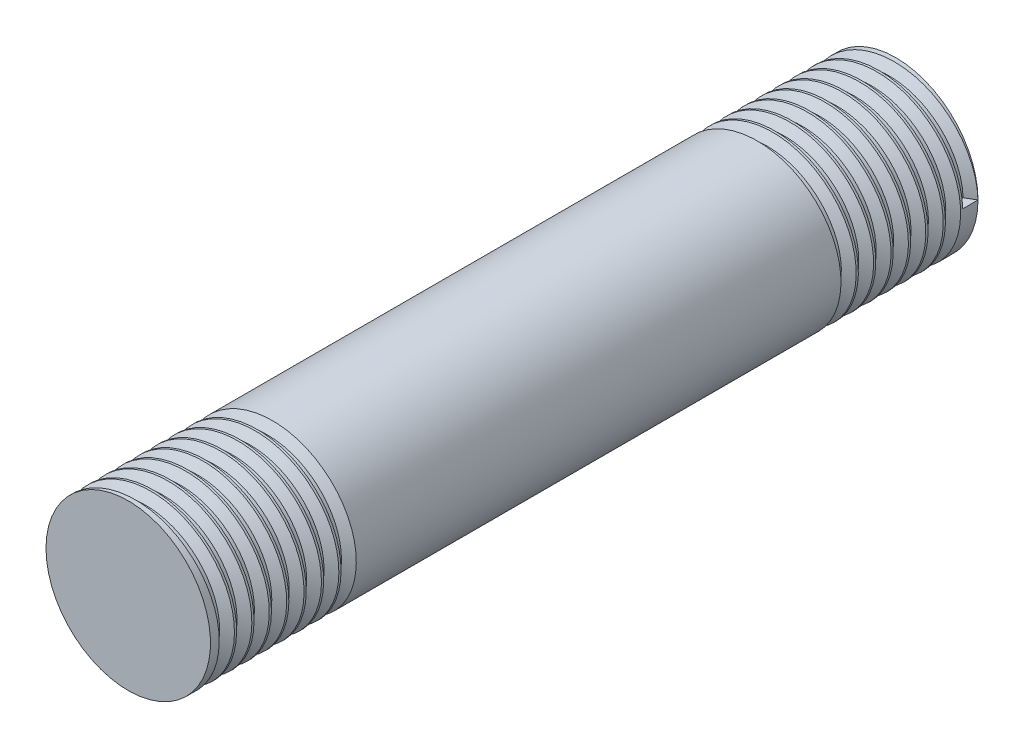
from build123d import *

# Parameters (mm, degrees)
SKETCH1_R           = 1.5
BOSS_EXTRUDE1_DEPTH = 14
THREAD1_PITCH       = 0.3175
THREAD2_PITCH       = 0.3175


with BuildPart() as part:
    # Sketch1 → Boss-Extrude1 (new body)
    with BuildSketch(Plane.XY):
        Circle(SKETCH1_R)
    extrude(amount=BOSS_EXTRUDE1_DEPTH)

    # Thread1: the profile of Thread Profile1 profile screwed along a right-hand helix of 7.874016 turns, 6 arcs to a turn; built about Z, then put on its axis
    thread1_z = Axis((0, 0, 0), (0, 0, 1))
    thread1_corners = [(1.5003, 0, -0.000173205), (1.5003, 0, 0.277985704), (1.328148085, 0, 0.17859375), (1.328148085, 0, 0.09921875)]
    with BuildLine(mode=Mode.PRIVATE) as thread1_profile:
        Line(thread1_corners[0], thread1_corners[1])
        Line(thread1_corners[1], thread1_corners[2])
        Line(thread1_corners[2], thread1_corners[3])
        Line(thread1_corners[3], thread1_corners[0])
    thread1_cap = Face(thread1_profile.wire())
    thread1_turn_angles = [0, 30, 60, 90, 120, 150, 180, 210, 240, 270, 300, 330, 360]
    thread1_turn_weights = [1, 0.8660254037844387, 1, 0.8660254037844387, 1, 0.8660254037844387, 1, 0.8660254037844387, 1, 0.8660254037844387, 1, 0.8660254037844387, 1]
    thread1_turn_rails = [Edge.make_bspline([Vector(p[0], p[1], 0).rotate(thread1_z, thread1_turn_angles[k]) / thread1_turn_weights[k] + Vector(0, 0, p[2] + THREAD1_PITCH * thread1_turn_angles[k] / 360) for k in range(13)], [0, 0, 0, 1, 1, 2, 2, 3, 3, 4, 4, 5, 5, 6, 6, 6], 2, thread1_turn_weights) for p in thread1_corners]
    thread1_turn_sides = [Face.make_surface_from_curves(thread1_turn_rails[p[0]], thread1_turn_rails[p[1]]) for p in [(0, 1), (1, 2), (2, 3), (3, 0)]]
    thread1_last_angles = [2520, 2550, 2580, 2610, 2640, 2670, 2700, 2730, 2760, 2790, 2820, 2827.322834646, 2834.645669291]
    thread1_last_weights = [1, 0.8660254037844387, 1, 0.8660254037844387, 1, 0.8660254037844387, 1, 0.8660254037844387, 1, 0.8660254037844387, 1, 0.9918437235207201, 1]
    thread1_last_rails = [Edge.make_bspline([Vector(p[0], p[1], 0).rotate(thread1_z, thread1_last_angles[k]) / thread1_last_weights[k] + Vector(0, 0, p[2] + THREAD1_PITCH * thread1_last_angles[k] / 360) for k in range(13)], [0, 0, 0, 1, 1, 2, 2, 3, 3, 4, 4, 5, 5, 6, 6, 6], 2, thread1_last_weights) for p in thread1_corners]
    thread1_last_sides = [Face.make_surface_from_curves(thread1_last_rails[p[0]], thread1_last_rails[p[1]]) for p in [(0, 1), (1, 2), (2, 3), (3, 0)]]
    thread1 = Plane(origin=(0, 0, 14), x_dir=(-1, 0, 0), z_dir=(0, 0, -1)) * Solid(Shell([*[p.moved(Location((0, 0, THREAD1_PITCH * i))) for i in range(7) for p in thread1_turn_sides], *thread1_last_sides, thread1_cap, thread1_cap.rotate(thread1_z, 2834.645669291).moved(Location((0, 0, THREAD1_PITCH * 2834.645669291 / 360)))]))
    add(thread1, mode=Mode.SUBTRACT)

    # Thread2: the profile of Thread Profile2 profile screwed along a right-hand helix of 7.874016 turns, 6 arcs to a turn; built about Z, then put on its axis
    thread2_z = Axis((0, 0, 0), (0, 0, 1))
    thread2_corners = [(1.5003, 0, -0.000173205), (1.5003, 0, 0.277985704), (1.328148085, 0, 0.17859375), (1.328148085, 0, 0.09921875)]
    with BuildLine(mode=Mode.PRIVATE) as thread2_profile:
        Line(thread2_corners[0], thread2_corners[1])
        Line(thread2_corners[1], thread2_corners[2])
        Line(thread2_corners[2], thread2_corners[3])
        Line(thread2_corners[3], thread2_corners[0])
    thread2_cap = Face(thread2_profile.wire())
    thread2_turn_angles = [0, 30, 60, 90, 120, 150, 180, 210, 240, 270, 300, 330, 360]
    thread2_turn_weights = [1, 0.8660254037844387, 1, 0.8660254037844387, 1, 0.8660254037844387, 1, 0.8660254037844387, 1, 0.8660254037844387, 1, 0.8660254037844387, 1]
    thread2_turn_rails = [Edge.make_bspline([Vector(p[0], p[1], 0).rotate(thread2_z, thread2_turn_angles[k]) / thread2_turn_weights[k] + Vector(0, 0, p[2] + THREAD2_PITCH * thread2_turn_angles[k] / 360) for k in range(13)], [0, 0, 0, 1, 1, 2, 2, 3, 3, 4, 4, 5, 5, 6, 6, 6], 2, thread2_turn_weights) for p in thread2_corners]
    thread2_turn_sides = [Face.make_surface_from_curves(thread2_turn_rails[p[0]], thread2_turn_rails[p[1]]) for p in [(0, 1), (1, 2), (2, 3), (3, 0)]]
    thread2_last_angles = [2520, 2550, 2580, 2610, 2640, 2670, 2700, 2730, 2760, 2790, 2820, 2827.322834646, 2834.645669291]
    thread2_last_weights = [1, 0.8660254037844387, 1, 0.8660254037844387, 1, 0.8660254037844387, 1, 0.8660254037844387, 1, 0.8660254037844387, 1, 0.9918437235207201, 1]
    thread2_last_rails = [Edge.make_bspline([Vector(p[0], p[1], 0).rotate(thread2_z, thread2_last_angles[k]) / thread2_last_weights[k] + Vector(0, 0, p[2] + THREAD2_PITCH * thread2_last_angles[k] / 360) for k in range(13)], [0, 0, 0, 1, 1, 2, 2, 3, 3, 4, 4, 5, 5, 6, 6, 6], 2, thread2_last_weights) for p in thread2_corners]
    thread2_last_sides = [Face.make_surface_from_curves(thread2_last_rails[p[0]], thread2_last_rails[p[1]]) for p in [(0, 1), (1, 2), (2, 3), (3, 0)]]
    thread2 = Plane(origin=(0, 0, 0), x_dir=(1, 0, 0), z_dir=(0, 0, 1)) * Solid(Shell([*[p.moved(Location((0, 0, THREAD2_PITCH * i))) for i in range(7) for p in thread2_turn_sides], *thread2_last_sides, thread2_cap, thread2_cap.rotate(thread2_z, 2834.645669291).moved(Location((0, 0, THREAD2_PITCH * 2834.645669291 / 360)))]))
    add(thread2, mode=Mode.SUBTRACT)


solid = part.part
